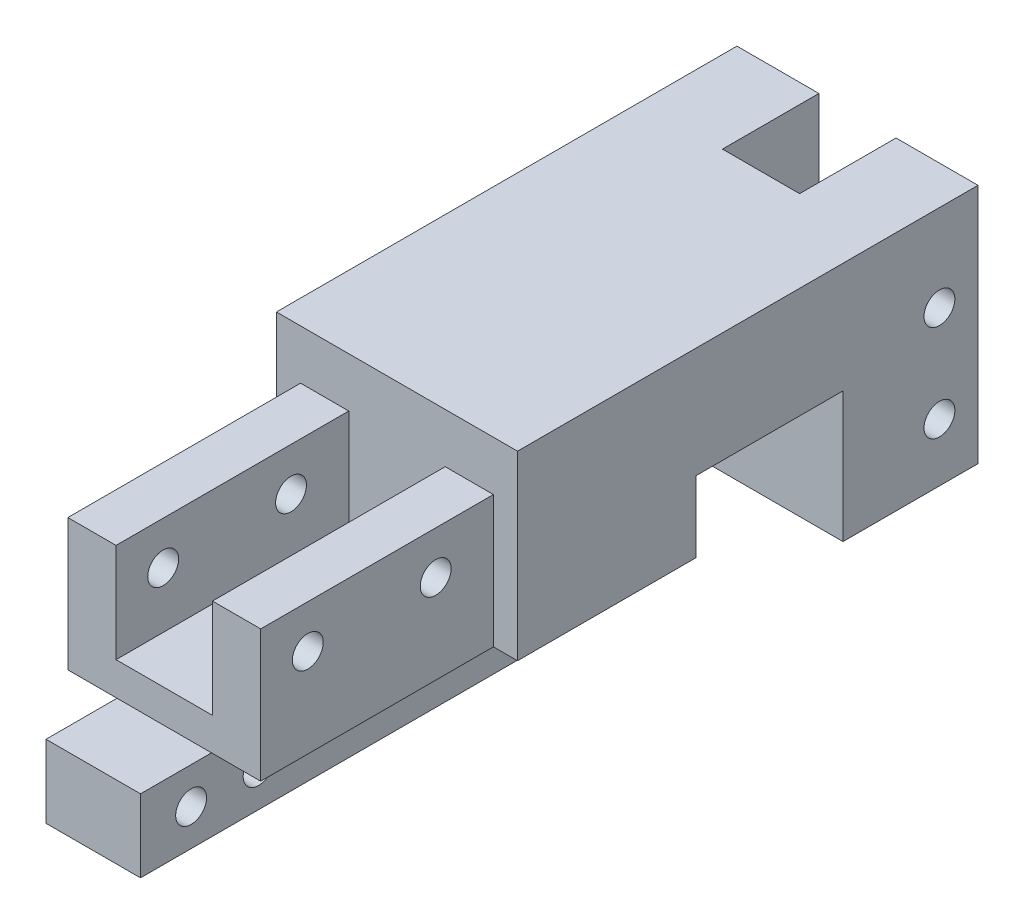
from build123d import *

# Parameters (mm, degrees)
SKETCH_2_W          = 50
SKETCH_2_H          = 7.55
SKETCH_2_R          = 1.6
EXTRUDE_1_DEPTH     = 4.9
SKETCH_3_W          = 24.132891974
SKETCH_3_H          = 13.680093874
SKETCH_3_R          = 1.6
EXTRUDE_2_DEPTH     = 10
SKETCH_4_W          = 10
SKETCH_4_H          = 10.264550668
CUT_EXTRUDE_1_DEPTH = 48.143107127
SKETCH_6_W          = 14
SKETCH_6_H          = 25
SKETCH_6_R          = 1.6
EXTRUDE_4_DEPTH     = 12.5
SKETCH_7_W          = 8
SKETCH_7_H          = 25
CUT_EXTRUDE_2_DEPTH = 10
EXTRUDE_5_DEPTH     = 12.5


with BuildPart() as part:
    # 草图2 → 凸台-拉伸1 (new, symmetric)
    with BuildSketch(Plane(origin=(0, 0, 0), x_dir=(0, 0, -1), z_dir=(1, 0, 0))):
        with Locations((19.75, 0)):
            Rectangle(SKETCH_2_W, SKETCH_2_H)
        Circle(SKETCH_2_R, mode=Mode.SUBTRACT)
        with Locations((7, 0)):
            Circle(SKETCH_2_R, mode=Mode.SUBTRACT)
        with Locations((32.5, 0)):
            Circle(SKETCH_2_R, mode=Mode.SUBTRACT)
        with Locations((39.5, 0)):
            Circle(SKETCH_2_R, mode=Mode.SUBTRACT)
    extrude(amount=EXTRUDE_1_DEPTH, both=True)

    # 草图3 → 凸台-拉伸2 (add, symmetric)
    with BuildSketch(Plane(origin=(0, 0, 0), x_dir=(0, 0, -1), z_dir=(1, 0, 0))):
        with Locations((14.180871083, 10.615046937)):
            Rectangle(SKETCH_3_W, SKETCH_3_H)
        with Locations((7, 13)):
            Circle(SKETCH_3_R, mode=Mode.SUBTRACT)
        with Locations((20.26, 13)):
            Circle(SKETCH_3_R, mode=Mode.SUBTRACT)
    extrude(amount=EXTRUDE_2_DEPTH, both=True)

    # 草图4 → 切除-拉伸1 (cut, through all)
    with BuildSketch(Plane.XY.offset(-2.114425096)):
        with Locations((0, 12.32281854)):
            Rectangle(SKETCH_4_W, SKETCH_4_H)
    extrude(amount=-CUT_EXTRUDE_1_DEPTH, mode=Mode.SUBTRACT)



with BuildPart() as body_2:
    # 草图6 → 凸台-拉伸4 (new, symmetric)
    with BuildSketch(Plane(origin=(0, 0, 0), x_dir=(0, 0, -1), z_dir=(1, 0, 0))):
        with Locations((67, 10.1)):
            Rectangle(SKETCH_6_W, SKETCH_6_H)
        with Locations((70, 3.6)):
            Circle(SKETCH_6_R, mode=Mode.SUBTRACT)
        with Locations((70, 13.6)):
            Circle(SKETCH_6_R, mode=Mode.SUBTRACT)
    extrude(amount=EXTRUDE_4_DEPTH, both=True)

    # 草图7 → 切除-拉伸2 (cut)
    with BuildSketch(Plane.XY.offset(-74)):
        with Locations((0, 10.1)):
            Rectangle(SKETCH_7_W, SKETCH_7_H)
    extrude(amount=CUT_EXTRUDE_2_DEPTH, mode=Mode.SUBTRACT)


with BuildPart() as part_1:
    add(part.part)

    add(body_2.part)  # 凸台-拉伸5 merges body 2
    # 草图8 → 凸台-拉伸5 (add, symmetric)
    with BuildSketch(Plane(origin=(0, 0, 0), x_dir=(0, 0, -1), z_dir=(1, 0, 0))):
        Polygon((60, 22.6), (26.24731707, 22.6), (26.24731707, 11.139938787), (26.24731707, 3.775), (44.75, 3.775), (44.75, 11.139938787), (60, 11.139938787), align=None)
    extrude(amount=EXTRUDE_5_DEPTH, both=True)


solid = part_1.part
